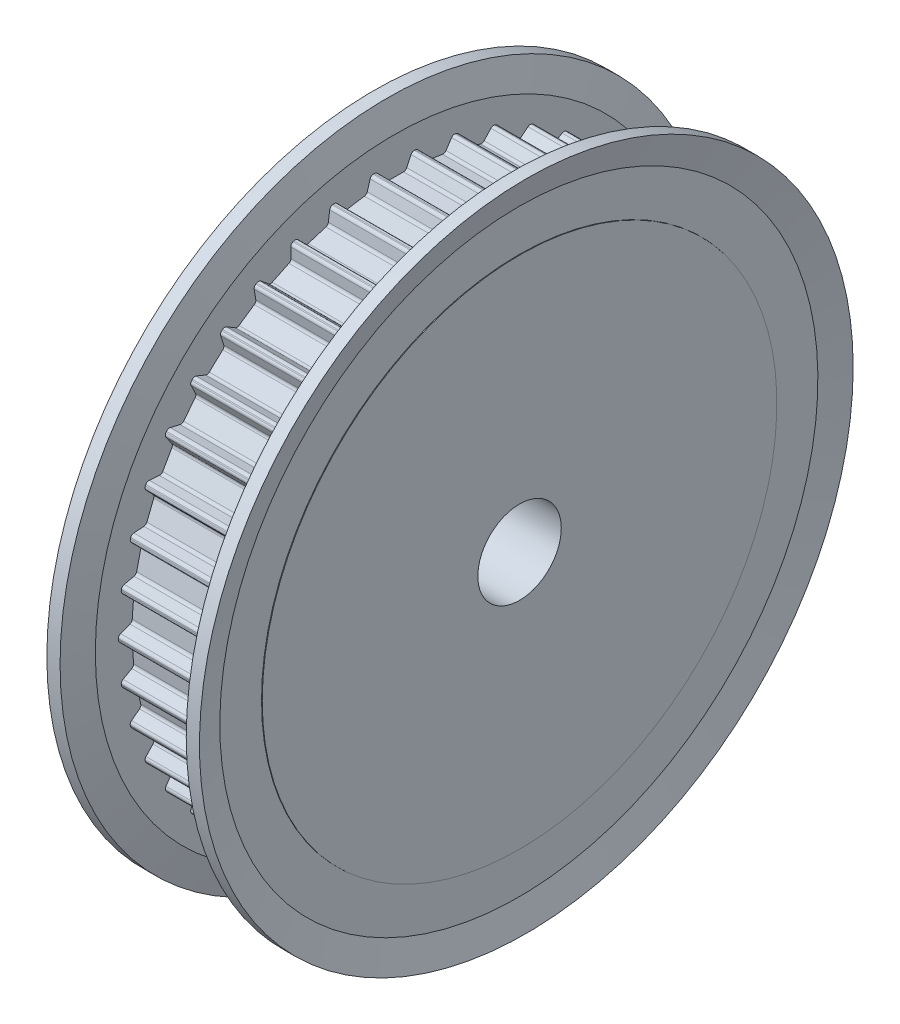
from build123d import *

# Parameters (mm, degrees)
REVOLVE1_START               = 0.05
REVOLVE1_DEPTH               = 9.9
REVOLVE1_START_2             = 9.535898285
REVOLVE1_2_OUTLINE_R         = 23.5
REVOLVE1_2_DEPTH             = 0.414101715
REVOLVE1_3_OUTLINE_R         = 23.5
REVOLVE1_3_DEPTH             = 0.414101515
REVOLVE1_4_OUTLINE_R         = 18.5
REVOLVE1_4_DEPTH             = 0.05
F_6_0_6_DIAMETER_HOLE1_D     = 6
F_6_0_6_DIAMETER_HOLE1_DEPTH = 16.485898385
FILLET1_R                    = 0.25
SKETCH6_R                    = 13
CUT_EXTRUDE2_DEPTH           = 6


with BuildPart() as part:
    # Revolve1: read off the stored shape, not the designer's step
    # Revolve1 outline → Revolve1 (new body)
    with BuildSketch(Plane.YZ.offset(REVOLVE1_START)):
        with BuildLine():
            ThreePointArc((-8.802769772, -17.791395233), (-8.612592221, -17.884232028), (-8.421435729, -17.975036029))
            Line((-8.421435729, -17.975036029), (-7.654649152, -17.245563817))
            Line((-7.654649152, -17.245563817), (-6.118707467, -17.848376507))
            Line((-6.118707467, -17.848376507), (-6.052780243, -18.904664803))
            ThreePointArc((-6.052780243, -18.904664803), (-5.850890212, -18.968120195), (-5.648335146, -19.029419594))
            Line((-5.648335146, -19.029419594), (-4.998835133, -18.193811374))
            Line((-4.998835133, -18.193811374), (-3.390204078, -18.560970915))
            Line((-3.390204078, -18.560970915), (-3.167581605, -19.595635401))
            ThreePointArc((-3.167581605, -19.595635401), (-2.958488984, -19.628291901), (-2.749060089, -19.65871737))
            Line((-2.749060089, -19.65871737), (-2.231355397, -18.73563925))
            Line((-2.231355397, -18.73563925), (-0.585969131, -18.858943904))
            Line((-0.585969131, -18.858943904), (-0.211624428, -19.848871885))
            ThreePointArc((-0.211624428, -19.848871885), (0, -19.85), (0.211624428, -19.848871885))
            Line((0.211624428, -19.848871885), (0.585969131, -18.858943904))
            Line((0.585969131, -18.858943904), (2.231355397, -18.73563925))
            Line((2.231355397, -18.73563925), (2.749060089, -19.65871737))
            ThreePointArc((2.749060089, -19.65871737), (2.958488984, -19.628291901), (3.167581605, -19.595635401))
            Line((3.167581605, -19.595635401), (3.390204078, -18.560970915))
            Line((3.390204078, -18.560970915), (4.998835133, -18.193811374))
            Line((4.998835133, -18.193811374), (5.648335146, -19.029419594))
            ThreePointArc((5.648335146, -19.029419594), (5.850890212, -18.968120195), (6.052780243, -18.904664803))
            Line((6.052780243, -18.904664803), (6.118707467, -17.848376507))
            Line((6.118707467, -17.848376507), (7.654649152, -17.245563817))
            Line((7.654649152, -17.245563817), (8.421435729, -17.975036029))
            ThreePointArc((8.421435729, -17.975036029), (8.612592221, -17.884232028), (8.802769772, -17.791395233))
            Line((8.802769772, -17.791395233), (8.710529042, -16.737078861))
            Line((8.710529042, -16.737078861), (10.139470958, -15.912078861))
            Line((10.139470958, -15.912078861), (11.006415354, -16.519119863))
            ThreePointArc((11.006415354, -16.519119863), (11.181903152, -16.40083967), (11.356119971, -16.280695293))
            Line((11.356119971, -16.280695293), (11.107771792, -15.251902531))
            Line((11.107771792, -15.251902531), (12.397793738, -14.223144358))
            Line((12.397793738, -14.223144358), (13.345529848, -14.694193856))
            ThreePointArc((13.345529848, -14.694193856), (13.501428845, -14.551079656), (13.655793215, -14.406311522))
            Line((13.655793215, -14.406311522), (13.256885275, -13.426023901))
            Line((13.256885275, -13.426023901), (14.379170293, -12.216488313))
            Line((14.379170293, -12.216488313), (15.386527258, -12.541023839))
            ThreePointArc((15.386527258, -12.541023839), (15.519354927, -12.376272567), (15.650418604, -12.210114558))
            Line((15.650418604, -12.210114558), (15.109861848, -11.300230083))
            Line((15.109861848, -11.300230083), (16.039339944, -9.936936106))
            Line((16.039339944, -9.936936106), (17.083815075, -10.107708073))
            ThreePointArc((17.083815075, -10.107708073), (17.190604265, -9.925), (17.295439503, -9.741163812))
            Line((17.295439503, -9.741163812), (16.625309075, -8.922007798))
            Line((16.625309075, -8.922007798), (17.341217245, -7.435409166))
            Line((17.341217245, -7.435409166), (18.399478692, -7.448602812))
            ThreePointArc((18.399478692, -7.448602812), (18.477843911, -7.252019334), (18.554108863, -7.054611562))
            Line((18.554108863, -7.054611562), (17.76937437, -6.344482602))
            Line((17.76937437, -6.344482602), (18.255720408, -4.767787473))
            Line((18.255720408, -4.767787473), (19.30412836, -4.623108072))
            ThreePointArc((19.30412836, -4.623108072), (19.352319057, -4.417040539), (19.398310091, -4.210470948))
            Line((19.398310091, -4.210470948), (18.516501205, -3.625232149))
            Line((18.516501205, -3.625232149), (18.762420944, -1.993661286))
            Line((18.762420944, -1.993661286), (19.7775557, -1.694340737))
            ThreePointArc((19.7775557, -1.694340737), (19.794495374, -1.483392358), (19.809185127, -1.27227537))
            Line((19.809185127, -1.27227537), (18.85, -0.825))
            Line((18.85, -0.825), (18.85, 0.825))
            Line((18.85, 0.825), (19.809185127, 1.27227537))
            ThreePointArc((19.809185127, 1.27227537), (19.794495374, 1.483392358), (19.7775557, 1.694340737))
            Line((19.7775557, 1.694340737), (18.762420944, 1.993661286))
            Line((18.762420944, 1.993661286), (18.516501205, 3.625232149))
            Line((18.516501205, 3.625232149), (19.398310091, 4.210470948))
            ThreePointArc((19.398310091, 4.210470948), (19.352319057, 4.417040539), (19.30412836, 4.623108072))
            Line((19.30412836, 4.623108072), (18.255720408, 4.767787473))
            Line((18.255720408, 4.767787473), (17.76937437, 6.344482602))
            Line((17.76937437, 6.344482602), (18.554108863, 7.054611562))
            ThreePointArc((18.554108863, 7.054611562), (18.477843911, 7.252019334), (18.399478692, 7.448602812))
            Line((18.399478692, 7.448602812), (17.341217245, 7.435409166))
            Line((17.341217245, 7.435409166), (16.625309075, 8.922007798))
            Line((16.625309075, 8.922007798), (17.295439503, 9.741163812))
            ThreePointArc((17.295439503, 9.741163812), (17.190604265, 9.925), (17.083815075, 10.107708073))
            Line((17.083815075, 10.107708073), (16.039339944, 9.936936106))
            Line((16.039339944, 9.936936106), (15.109861848, 11.300230083))
            Line((15.109861848, 11.300230083), (15.650418604, 12.210114558))
            ThreePointArc((15.650418604, 12.210114558), (15.519354927, 12.376272567), (15.386527258, 12.541023839))
            Line((15.386527258, 12.541023839), (14.379170293, 12.216488313))
            Line((14.379170293, 12.216488313), (13.256885275, 13.426023901))
            Line((13.256885275, 13.426023901), (13.655793215, 14.406311522))
            ThreePointArc((13.655793215, 14.406311522), (13.501428845, 14.551079656), (13.345529848, 14.694193856))
            Line((13.345529848, 14.694193856), (12.397793738, 14.223144358))
            Line((12.397793738, 14.223144358), (11.107771792, 15.251902531))
            Line((11.107771792, 15.251902531), (11.356119971, 16.280695293))
            ThreePointArc((11.356119971, 16.280695293), (11.181903152, 16.40083967), (11.006415354, 16.519119863))
            Line((11.006415354, 16.519119863), (10.139470958, 15.912078861))
            Line((10.139470958, 15.912078861), (8.710529042, 16.737078861))
            Line((8.710529042, 16.737078861), (8.802769772, 17.791395233))
            ThreePointArc((8.802769772, 17.791395233), (8.612592221, 17.884232028), (8.421435729, 17.975036029))
            Line((8.421435729, 17.975036029), (7.654649152, 17.245563817))
            Line((7.654649152, 17.245563817), (6.118707467, 17.848376507))
            Line((6.118707467, 17.848376507), (6.052780243, 18.904664803))
            ThreePointArc((6.052780243, 18.904664803), (5.850890212, 18.968120195), (5.648335146, 19.029419594))
            Line((5.648335146, 19.029419594), (4.998835133, 18.193811374))
            Line((4.998835133, 18.193811374), (3.390204078, 18.560970915))
            Line((3.390204078, 18.560970915), (3.167581605, 19.595635401))
            ThreePointArc((3.167581605, 19.595635401), (2.958488984, 19.628291901), (2.749060089, 19.65871737))
            Line((2.749060089, 19.65871737), (2.231355397, 18.73563925))
            Line((2.231355397, 18.73563925), (0.585969131, 18.858943904))
            Line((0.585969131, 18.858943904), (0.211624428, 19.848871885))
            ThreePointArc((0.211624428, 19.848871885), (0, 19.85), (-0.211624428, 19.848871885))
            Line((-0.211624428, 19.848871885), (-0.585969131, 18.858943904))
            Line((-0.585969131, 18.858943904), (-2.231355397, 18.73563925))
            Line((-2.231355397, 18.73563925), (-2.749060089, 19.65871737))
            ThreePointArc((-2.749060089, 19.65871737), (-2.958488984, 19.628291901), (-3.167581605, 19.595635401))
            Line((-3.167581605, 19.595635401), (-3.390204078, 18.560970915))
            Line((-3.390204078, 18.560970915), (-4.998835133, 18.193811374))
            Line((-4.998835133, 18.193811374), (-5.648335146, 19.029419594))
            ThreePointArc((-5.648335146, 19.029419594), (-5.850890212, 18.968120195), (-6.052780243, 18.904664803))
            Line((-6.052780243, 18.904664803), (-6.118707467, 17.848376507))
            Line((-6.118707467, 17.848376507), (-7.654649152, 17.245563817))
            Line((-7.654649152, 17.245563817), (-8.421435729, 17.975036029))
            ThreePointArc((-8.421435729, 17.975036029), (-8.612592221, 17.884232028), (-8.802769772, 17.791395233))
            Line((-8.802769772, 17.791395233), (-8.710529042, 16.737078861))
            Line((-8.710529042, 16.737078861), (-10.139470958, 15.912078861))
            Line((-10.139470958, 15.912078861), (-11.006415354, 16.519119863))
            ThreePointArc((-11.006415354, 16.519119863), (-11.181903152, 16.40083967), (-11.356119971, 16.280695293))
            Line((-11.356119971, 16.280695293), (-11.107771792, 15.251902531))
            Line((-11.107771792, 15.251902531), (-12.397793738, 14.223144358))
            Line((-12.397793738, 14.223144358), (-13.345529848, 14.694193856))
            ThreePointArc((-13.345529848, 14.694193856), (-13.501428845, 14.551079656), (-13.655793215, 14.406311522))
            Line((-13.655793215, 14.406311522), (-13.256885275, 13.426023901))
            Line((-13.256885275, 13.426023901), (-14.379170293, 12.216488313))
            Line((-14.379170293, 12.216488313), (-15.386527258, 12.541023839))
            ThreePointArc((-15.386527258, 12.541023839), (-15.519354927, 12.376272567), (-15.650418604, 12.210114558))
            Line((-15.650418604, 12.210114558), (-15.109861848, 11.300230083))
            Line((-15.109861848, 11.300230083), (-16.039339944, 9.936936106))
            Line((-16.039339944, 9.936936106), (-17.083815075, 10.107708073))
            ThreePointArc((-17.083815075, 10.107708073), (-17.190604265, 9.925), (-17.295439503, 9.741163812))
            Line((-17.295439503, 9.741163812), (-16.625309075, 8.922007798))
            Line((-16.625309075, 8.922007798), (-17.341217245, 7.435409166))
            Line((-17.341217245, 7.435409166), (-18.399478692, 7.448602812))
            ThreePointArc((-18.399478692, 7.448602812), (-18.477843911, 7.252019334), (-18.554108863, 7.054611562))
            Line((-18.554108863, 7.054611562), (-17.76937437, 6.344482602))
            Line((-17.76937437, 6.344482602), (-18.255720408, 4.767787473))
            Line((-18.255720408, 4.767787473), (-19.30412836, 4.623108072))
            ThreePointArc((-19.30412836, 4.623108072), (-19.352319057, 4.417040539), (-19.398310091, 4.210470948))
            Line((-19.398310091, 4.210470948), (-18.516501205, 3.625232149))
            Line((-18.516501205, 3.625232149), (-18.762420944, 1.993661286))
            Line((-18.762420944, 1.993661286), (-19.7775557, 1.694340737))
            ThreePointArc((-19.7775557, 1.694340737), (-19.794495374, 1.483392358), (-19.809185127, 1.27227537))
            Line((-19.809185127, 1.27227537), (-18.85, 0.825))
            Line((-18.85, 0.825), (-18.85, -0.825))
            Line((-18.85, -0.825), (-19.809185127, -1.27227537))
            ThreePointArc((-19.809185127, -1.27227537), (-19.794495374, -1.483392358), (-19.7775557, -1.694340737))
            Line((-19.7775557, -1.694340737), (-18.762420944, -1.993661286))
            Line((-18.762420944, -1.993661286), (-18.516501205, -3.625232149))
            Line((-18.516501205, -3.625232149), (-19.398310091, -4.210470948))
            ThreePointArc((-19.398310091, -4.210470948), (-19.352319057, -4.417040539), (-19.30412836, -4.623108072))
            Line((-19.30412836, -4.623108072), (-18.255720408, -4.767787473))
            Line((-18.255720408, -4.767787473), (-17.76937437, -6.344482602))
            Line((-17.76937437, -6.344482602), (-18.554108863, -7.054611562))
            ThreePointArc((-18.554108863, -7.054611562), (-18.477843911, -7.252019334), (-18.399478692, -7.448602812))
            Line((-18.399478692, -7.448602812), (-17.341217245, -7.435409166))
            Line((-17.341217245, -7.435409166), (-16.625309075, -8.922007798))
            Line((-16.625309075, -8.922007798), (-17.295439503, -9.741163812))
            ThreePointArc((-17.295439503, -9.741163812), (-17.190604265, -9.925), (-17.083815075, -10.107708073))
            Line((-17.083815075, -10.107708073), (-16.039339944, -9.936936106))
            Line((-16.039339944, -9.936936106), (-15.109861848, -11.300230083))
            Line((-15.109861848, -11.300230083), (-15.650418604, -12.210114558))
            ThreePointArc((-15.650418604, -12.210114558), (-15.519354927, -12.376272567), (-15.386527258, -12.541023839))
            Line((-15.386527258, -12.541023839), (-14.379170293, -12.216488313))
            Line((-14.379170293, -12.216488313), (-13.256885275, -13.426023901))
            Line((-13.256885275, -13.426023901), (-13.655793215, -14.406311522))
            ThreePointArc((-13.655793215, -14.406311522), (-13.501428845, -14.551079656), (-13.345529848, -14.694193856))
            Line((-13.345529848, -14.694193856), (-12.397793738, -14.223144358))
            Line((-12.397793738, -14.223144358), (-11.107771792, -15.251902531))
            Line((-11.107771792, -15.251902531), (-11.356119971, -16.280695293))
            ThreePointArc((-11.356119971, -16.280695293), (-11.181903152, -16.40083967), (-11.006415354, -16.519119863))
            Line((-11.006415354, -16.519119863), (-10.139470958, -15.912078861))
            Line((-10.139470958, -15.912078861), (-8.710529042, -16.737078861))
            Line((-8.710529042, -16.737078861), (-8.802769772, -17.791395233))
        make_face()
    extrude(amount=REVOLVE1_DEPTH)

    # Revolve1 2 outline → Revolve1 2 (add)
    with BuildSketch(Plane.YZ.offset(REVOLVE1_START_2)):
        Circle(REVOLVE1_2_OUTLINE_R)
        with BuildLine():
            Line((-7.654649152, -17.245563817), (-8.421435729, -17.975036029))
            ThreePointArc((-8.421435729, -17.975036029), (-8.612592221, -17.884232028), (-8.802769772, -17.791395233))
            Line((-8.802769772, -17.791395233), (-8.710529042, -16.737078861))
            Line((-8.710529042, -16.737078861), (-10.139470958, -15.912078861))
            Line((-10.139470958, -15.912078861), (-11.006415354, -16.519119863))
            ThreePointArc((-11.006415354, -16.519119863), (-11.181903152, -16.40083967), (-11.356119971, -16.280695293))
            Line((-11.356119971, -16.280695293), (-11.107771792, -15.251902531))
            Line((-11.107771792, -15.251902531), (-12.397793738, -14.223144358))
            Line((-12.397793738, -14.223144358), (-13.345529848, -14.694193856))
            ThreePointArc((-13.345529848, -14.694193856), (-13.501428845, -14.551079656), (-13.655793215, -14.406311522))
            Line((-13.655793215, -14.406311522), (-13.256885275, -13.426023901))
            Line((-13.256885275, -13.426023901), (-14.379170293, -12.216488313))
            Line((-14.379170293, -12.216488313), (-15.386527258, -12.541023839))
            ThreePointArc((-15.386527258, -12.541023839), (-15.519354927, -12.376272567), (-15.650418604, -12.210114558))
            Line((-15.650418604, -12.210114558), (-15.109861848, -11.300230083))
            Line((-15.109861848, -11.300230083), (-16.039339944, -9.936936106))
            Line((-16.039339944, -9.936936106), (-17.083815075, -10.107708073))
            ThreePointArc((-17.083815075, -10.107708073), (-17.190604265, -9.925), (-17.295439503, -9.741163812))
            Line((-17.295439503, -9.741163812), (-16.625309075, -8.922007798))
            Line((-16.625309075, -8.922007798), (-17.341217245, -7.435409166))
            Line((-17.341217245, -7.435409166), (-18.399478692, -7.448602812))
            ThreePointArc((-18.399478692, -7.448602812), (-18.477843911, -7.252019334), (-18.554108863, -7.054611562))
            Line((-18.554108863, -7.054611562), (-17.76937437, -6.344482602))
            Line((-17.76937437, -6.344482602), (-18.255720408, -4.767787473))
            Line((-18.255720408, -4.767787473), (-19.30412836, -4.623108072))
            ThreePointArc((-19.30412836, -4.623108072), (-19.352319057, -4.417040539), (-19.398310091, -4.210470948))
            Line((-19.398310091, -4.210470948), (-18.516501205, -3.625232149))
            Line((-18.516501205, -3.625232149), (-18.762420944, -1.993661286))
            Line((-18.762420944, -1.993661286), (-19.7775557, -1.694340737))
            ThreePointArc((-19.7775557, -1.694340737), (-19.794495374, -1.483392358), (-19.809185127, -1.27227537))
            Line((-19.809185127, -1.27227537), (-18.85, -0.825))
            Line((-18.85, -0.825), (-18.85, 0.825))
            Line((-18.85, 0.825), (-19.809185127, 1.27227537))
            ThreePointArc((-19.809185127, 1.27227537), (-19.794495374, 1.483392358), (-19.7775557, 1.694340737))
            Line((-19.7775557, 1.694340737), (-18.762420944, 1.993661286))
            Line((-18.762420944, 1.993661286), (-18.516501205, 3.625232149))
            Line((-18.516501205, 3.625232149), (-19.398310091, 4.210470948))
            ThreePointArc((-19.398310091, 4.210470948), (-19.352319057, 4.417040539), (-19.30412836, 4.623108072))
            Line((-19.30412836, 4.623108072), (-18.255720408, 4.767787473))
            Line((-18.255720408, 4.767787473), (-17.76937437, 6.344482602))
            Line((-17.76937437, 6.344482602), (-18.554108863, 7.054611562))
            ThreePointArc((-18.554108863, 7.054611562), (-18.477843911, 7.252019334), (-18.399478692, 7.448602812))
            Line((-18.399478692, 7.448602812), (-17.341217245, 7.435409166))
            Line((-17.341217245, 7.435409166), (-16.625309075, 8.922007798))
            Line((-16.625309075, 8.922007798), (-17.295439503, 9.741163812))
            ThreePointArc((-17.295439503, 9.741163812), (-17.190604265, 9.925), (-17.083815075, 10.107708073))
            Line((-17.083815075, 10.107708073), (-16.039339944, 9.936936106))
            Line((-16.039339944, 9.936936106), (-15.109861848, 11.300230083))
            Line((-15.109861848, 11.300230083), (-15.650418604, 12.210114558))
            ThreePointArc((-15.650418604, 12.210114558), (-15.519354927, 12.376272567), (-15.386527258, 12.541023839))
            Line((-15.386527258, 12.541023839), (-14.379170293, 12.216488313))
            Line((-14.379170293, 12.216488313), (-13.256885275, 13.426023901))
            Line((-13.256885275, 13.426023901), (-13.655793215, 14.406311522))
            ThreePointArc((-13.655793215, 14.406311522), (-13.501428845, 14.551079656), (-13.345529848, 14.694193856))
            Line((-13.345529848, 14.694193856), (-12.397793738, 14.223144358))
            Line((-12.397793738, 14.223144358), (-11.107771792, 15.251902531))
            Line((-11.107771792, 15.251902531), (-11.356119971, 16.280695293))
            ThreePointArc((-11.356119971, 16.280695293), (-11.181903152, 16.40083967), (-11.006415354, 16.519119863))
            Line((-11.006415354, 16.519119863), (-10.139470958, 15.912078861))
            Line((-10.139470958, 15.912078861), (-8.710529042, 16.737078861))
            Line((-8.710529042, 16.737078861), (-8.802769772, 17.791395233))
            ThreePointArc((-8.802769772, 17.791395233), (-8.612592221, 17.884232028), (-8.421435729, 17.975036029))
            Line((-8.421435729, 17.975036029), (-7.654649152, 17.245563817))
            Line((-7.654649152, 17.245563817), (-6.118707467, 17.848376507))
            Line((-6.118707467, 17.848376507), (-6.052780243, 18.904664803))
            ThreePointArc((-6.052780243, 18.904664803), (-5.850890212, 18.968120195), (-5.648335146, 19.029419594))
            Line((-5.648335146, 19.029419594), (-4.998835133, 18.193811374))
            Line((-4.998835133, 18.193811374), (-3.390204078, 18.560970915))
            Line((-3.390204078, 18.560970915), (-3.167581605, 19.595635401))
            ThreePointArc((-3.167581605, 19.595635401), (-2.958488984, 19.628291901), (-2.749060089, 19.65871737))
            Line((-2.749060089, 19.65871737), (-2.231355397, 18.73563925))
            Line((-2.231355397, 18.73563925), (-0.585969131, 18.858943904))
            Line((-0.585969131, 18.858943904), (-0.211624428, 19.848871885))
            ThreePointArc((-0.211624428, 19.848871885), (0, 19.85), (0.211624428, 19.848871885))
            Line((0.211624428, 19.848871885), (0.585969131, 18.858943904))
            Line((0.585969131, 18.858943904), (2.231355397, 18.73563925))
            Line((2.231355397, 18.73563925), (2.749060089, 19.65871737))
            ThreePointArc((2.749060089, 19.65871737), (2.958488984, 19.628291901), (3.167581605, 19.595635401))
            Line((3.167581605, 19.595635401), (3.390204078, 18.560970915))
            Line((3.390204078, 18.560970915), (4.998835133, 18.193811374))
            Line((4.998835133, 18.193811374), (5.648335146, 19.029419594))
            ThreePointArc((5.648335146, 19.029419594), (5.850890212, 18.968120195), (6.052780243, 18.904664803))
            Line((6.052780243, 18.904664803), (6.118707467, 17.848376507))
            Line((6.118707467, 17.848376507), (7.654649152, 17.245563817))
            Line((7.654649152, 17.245563817), (8.421435729, 17.975036029))
            ThreePointArc((8.421435729, 17.975036029), (8.612592221, 17.884232028), (8.802769772, 17.791395233))
            Line((8.802769772, 17.791395233), (8.710529042, 16.737078861))
            Line((8.710529042, 16.737078861), (10.139470958, 15.912078861))
            Line((10.139470958, 15.912078861), (11.006415354, 16.519119863))
            ThreePointArc((11.006415354, 16.519119863), (11.181903152, 16.40083967), (11.356119971, 16.280695293))
            Line((11.356119971, 16.280695293), (11.107771792, 15.251902531))
            Line((11.107771792, 15.251902531), (12.397793738, 14.223144358))
            Line((12.397793738, 14.223144358), (13.345529848, 14.694193856))
            ThreePointArc((13.345529848, 14.694193856), (13.501428845, 14.551079656), (13.655793215, 14.406311522))
            Line((13.655793215, 14.406311522), (13.256885275, 13.426023901))
            Line((13.256885275, 13.426023901), (14.379170293, 12.216488313))
            Line((14.379170293, 12.216488313), (15.386527258, 12.541023839))
            ThreePointArc((15.386527258, 12.541023839), (15.519354927, 12.376272567), (15.650418604, 12.210114558))
            Line((15.650418604, 12.210114558), (15.109861848, 11.300230083))
            Line((15.109861848, 11.300230083), (16.039339944, 9.936936106))
            Line((16.039339944, 9.936936106), (17.083815075, 10.107708073))
            ThreePointArc((17.083815075, 10.107708073), (17.190604265, 9.925), (17.295439503, 9.741163812))
            Line((17.295439503, 9.741163812), (16.625309075, 8.922007798))
            Line((16.625309075, 8.922007798), (17.341217245, 7.435409166))
            Line((17.341217245, 7.435409166), (18.399478692, 7.448602812))
            ThreePointArc((18.399478692, 7.448602812), (18.477843911, 7.252019334), (18.554108863, 7.054611562))
            Line((18.554108863, 7.054611562), (17.76937437, 6.344482602))
            Line((17.76937437, 6.344482602), (18.255720408, 4.767787473))
            Line((18.255720408, 4.767787473), (19.30412836, 4.623108072))
            ThreePointArc((19.30412836, 4.623108072), (19.352319057, 4.417040539), (19.398310091, 4.210470948))
            Line((19.398310091, 4.210470948), (18.516501205, 3.625232149))
            Line((18.516501205, 3.625232149), (18.762420944, 1.993661286))
            Line((18.762420944, 1.993661286), (19.7775557, 1.694340737))
            ThreePointArc((19.7775557, 1.694340737), (19.794495374, 1.483392358), (19.809185127, 1.27227537))
            Line((19.809185127, 1.27227537), (18.85, 0.825))
            Line((18.85, 0.825), (18.85, -0.825))
            Line((18.85, -0.825), (19.809185127, -1.27227537))
            ThreePointArc((19.809185127, -1.27227537), (19.794495374, -1.483392358), (19.7775557, -1.694340737))
            Line((19.7775557, -1.694340737), (18.762420944, -1.993661286))
            Line((18.762420944, -1.993661286), (18.516501205, -3.625232149))
            Line((18.516501205, -3.625232149), (19.398310091, -4.210470948))
            ThreePointArc((19.398310091, -4.210470948), (19.352319057, -4.417040539), (19.30412836, -4.623108072))
            Line((19.30412836, -4.623108072), (18.255720408, -4.767787473))
            Line((18.255720408, -4.767787473), (17.76937437, -6.344482602))
            Line((17.76937437, -6.344482602), (18.554108863, -7.054611562))
            ThreePointArc((18.554108863, -7.054611562), (18.477843911, -7.252019334), (18.399478692, -7.448602812))
            Line((18.399478692, -7.448602812), (17.341217245, -7.435409166))
            Line((17.341217245, -7.435409166), (16.625309075, -8.922007798))
            Line((16.625309075, -8.922007798), (17.295439503, -9.741163812))
            ThreePointArc((17.295439503, -9.741163812), (17.190604265, -9.925), (17.083815075, -10.107708073))
            Line((17.083815075, -10.107708073), (16.039339944, -9.936936106))
            Line((16.039339944, -9.936936106), (15.109861848, -11.300230083))
            Line((15.109861848, -11.300230083), (15.650418604, -12.210114558))
            ThreePointArc((15.650418604, -12.210114558), (15.519354927, -12.376272567), (15.386527258, -12.541023839))
            Line((15.386527258, -12.541023839), (14.379170293, -12.216488313))
            Line((14.379170293, -12.216488313), (13.256885275, -13.426023901))
            Line((13.256885275, -13.426023901), (13.655793215, -14.406311522))
            ThreePointArc((13.655793215, -14.406311522), (13.501428845, -14.551079656), (13.345529848, -14.694193856))
            Line((13.345529848, -14.694193856), (12.397793738, -14.223144358))
            Line((12.397793738, -14.223144358), (11.107771792, -15.251902531))
            Line((11.107771792, -15.251902531), (11.356119971, -16.280695293))
            ThreePointArc((11.356119971, -16.280695293), (11.181903152, -16.40083967), (11.006415354, -16.519119863))
            Line((11.006415354, -16.519119863), (10.139470958, -15.912078861))
            Line((10.139470958, -15.912078861), (8.710529042, -16.737078861))
            Line((8.710529042, -16.737078861), (8.802769772, -17.791395233))
            ThreePointArc((8.802769772, -17.791395233), (8.612592221, -17.884232028), (8.421435729, -17.975036029))
            Line((8.421435729, -17.975036029), (7.654649152, -17.245563817))
            Line((7.654649152, -17.245563817), (6.118707467, -17.848376507))
            Line((6.118707467, -17.848376507), (6.052780243, -18.904664803))
            ThreePointArc((6.052780243, -18.904664803), (5.850890212, -18.968120195), (5.648335146, -19.029419594))
            Line((5.648335146, -19.029419594), (4.998835133, -18.193811374))
            Line((4.998835133, -18.193811374), (3.390204078, -18.560970915))
            Line((3.390204078, -18.560970915), (3.167581605, -19.595635401))
            ThreePointArc((3.167581605, -19.595635401), (2.958488984, -19.628291901), (2.749060089, -19.65871737))
            Line((2.749060089, -19.65871737), (2.231355397, -18.73563925))
            Line((2.231355397, -18.73563925), (0.585969131, -18.858943904))
            Line((0.585969131, -18.858943904), (0.211624428, -19.848871885))
            ThreePointArc((0.211624428, -19.848871885), (0, -19.85), (-0.211624428, -19.848871885))
            Line((-0.211624428, -19.848871885), (-0.585969131, -18.858943904))
            Line((-0.585969131, -18.858943904), (-2.231355397, -18.73563925))
            Line((-2.231355397, -18.73563925), (-2.749060089, -19.65871737))
            ThreePointArc((-2.749060089, -19.65871737), (-2.958488984, -19.628291901), (-3.167581605, -19.595635401))
            Line((-3.167581605, -19.595635401), (-3.390204078, -18.560970915))
            Line((-3.390204078, -18.560970915), (-4.998835133, -18.193811374))
            Line((-4.998835133, -18.193811374), (-5.648335146, -19.029419594))
            ThreePointArc((-5.648335146, -19.029419594), (-5.850890212, -18.968120195), (-6.052780243, -18.904664803))
            Line((-6.052780243, -18.904664803), (-6.118707467, -17.848376507))
            Line((-6.118707467, -17.848376507), (-7.654649152, -17.245563817))
        make_face(mode=Mode.SUBTRACT)
    extrude(amount=REVOLVE1_2_DEPTH)

    # Revolve1 3 outline → Revolve1 3 (add)
    with BuildSketch(Plane.YZ.offset(REVOLVE1_START)):
        Circle(REVOLVE1_3_OUTLINE_R)
        with BuildLine():
            Line((-7.654649152, -17.245563817), (-8.421435729, -17.975036029))
            ThreePointArc((-8.421435729, -17.975036029), (-8.612592221, -17.884232028), (-8.802769772, -17.791395233))
            Line((-8.802769772, -17.791395233), (-8.710529042, -16.737078861))
            Line((-8.710529042, -16.737078861), (-10.139470958, -15.912078861))
            Line((-10.139470958, -15.912078861), (-11.006415354, -16.519119863))
            ThreePointArc((-11.006415354, -16.519119863), (-11.181903152, -16.40083967), (-11.356119971, -16.280695293))
            Line((-11.356119971, -16.280695293), (-11.107771792, -15.251902531))
            Line((-11.107771792, -15.251902531), (-12.397793738, -14.223144358))
            Line((-12.397793738, -14.223144358), (-13.345529848, -14.694193856))
            ThreePointArc((-13.345529848, -14.694193856), (-13.501428845, -14.551079656), (-13.655793215, -14.406311522))
            Line((-13.655793215, -14.406311522), (-13.256885275, -13.426023901))
            Line((-13.256885275, -13.426023901), (-14.379170293, -12.216488313))
            Line((-14.379170293, -12.216488313), (-15.386527258, -12.541023839))
            ThreePointArc((-15.386527258, -12.541023839), (-15.519354927, -12.376272567), (-15.650418604, -12.210114558))
            Line((-15.650418604, -12.210114558), (-15.109861848, -11.300230083))
            Line((-15.109861848, -11.300230083), (-16.039339944, -9.936936106))
            Line((-16.039339944, -9.936936106), (-17.083815075, -10.107708073))
            ThreePointArc((-17.083815075, -10.107708073), (-17.190604265, -9.925), (-17.295439503, -9.741163812))
            Line((-17.295439503, -9.741163812), (-16.625309075, -8.922007798))
            Line((-16.625309075, -8.922007798), (-17.341217245, -7.435409166))
            Line((-17.341217245, -7.435409166), (-18.399478692, -7.448602812))
            ThreePointArc((-18.399478692, -7.448602812), (-18.477843911, -7.252019334), (-18.554108863, -7.054611562))
            Line((-18.554108863, -7.054611562), (-17.76937437, -6.344482602))
            Line((-17.76937437, -6.344482602), (-18.255720408, -4.767787473))
            Line((-18.255720408, -4.767787473), (-19.30412836, -4.623108072))
            ThreePointArc((-19.30412836, -4.623108072), (-19.352319057, -4.417040539), (-19.398310091, -4.210470948))
            Line((-19.398310091, -4.210470948), (-18.516501205, -3.625232149))
            Line((-18.516501205, -3.625232149), (-18.762420944, -1.993661286))
            Line((-18.762420944, -1.993661286), (-19.7775557, -1.694340737))
            ThreePointArc((-19.7775557, -1.694340737), (-19.794495374, -1.483392358), (-19.809185127, -1.27227537))
            Line((-19.809185127, -1.27227537), (-18.85, -0.825))
            Line((-18.85, -0.825), (-18.85, 0.825))
            Line((-18.85, 0.825), (-19.809185127, 1.27227537))
            ThreePointArc((-19.809185127, 1.27227537), (-19.794495374, 1.483392358), (-19.7775557, 1.694340737))
            Line((-19.7775557, 1.694340737), (-18.762420944, 1.993661286))
            Line((-18.762420944, 1.993661286), (-18.516501205, 3.625232149))
            Line((-18.516501205, 3.625232149), (-19.398310091, 4.210470948))
            ThreePointArc((-19.398310091, 4.210470948), (-19.352319057, 4.417040539), (-19.30412836, 4.623108072))
            Line((-19.30412836, 4.623108072), (-18.255720408, 4.767787473))
            Line((-18.255720408, 4.767787473), (-17.76937437, 6.344482602))
            Line((-17.76937437, 6.344482602), (-18.554108863, 7.054611562))
            ThreePointArc((-18.554108863, 7.054611562), (-18.477843911, 7.252019334), (-18.399478692, 7.448602812))
            Line((-18.399478692, 7.448602812), (-17.341217245, 7.435409166))
            Line((-17.341217245, 7.435409166), (-16.625309075, 8.922007798))
            Line((-16.625309075, 8.922007798), (-17.295439503, 9.741163812))
            ThreePointArc((-17.295439503, 9.741163812), (-17.190604265, 9.925), (-17.083815075, 10.107708073))
            Line((-17.083815075, 10.107708073), (-16.039339944, 9.936936106))
            Line((-16.039339944, 9.936936106), (-15.109861848, 11.300230083))
            Line((-15.109861848, 11.300230083), (-15.650418604, 12.210114558))
            ThreePointArc((-15.650418604, 12.210114558), (-15.519354927, 12.376272567), (-15.386527258, 12.541023839))
            Line((-15.386527258, 12.541023839), (-14.379170293, 12.216488313))
            Line((-14.379170293, 12.216488313), (-13.256885275, 13.426023901))
            Line((-13.256885275, 13.426023901), (-13.655793215, 14.406311522))
            ThreePointArc((-13.655793215, 14.406311522), (-13.501428845, 14.551079656), (-13.345529848, 14.694193856))
            Line((-13.345529848, 14.694193856), (-12.397793738, 14.223144358))
            Line((-12.397793738, 14.223144358), (-11.107771792, 15.251902531))
            Line((-11.107771792, 15.251902531), (-11.356119971, 16.280695293))
            ThreePointArc((-11.356119971, 16.280695293), (-11.181903152, 16.40083967), (-11.006415354, 16.519119863))
            Line((-11.006415354, 16.519119863), (-10.139470958, 15.912078861))
            Line((-10.139470958, 15.912078861), (-8.710529042, 16.737078861))
            Line((-8.710529042, 16.737078861), (-8.802769772, 17.791395233))
            ThreePointArc((-8.802769772, 17.791395233), (-8.612592221, 17.884232028), (-8.421435729, 17.975036029))
            Line((-8.421435729, 17.975036029), (-7.654649152, 17.245563817))
            Line((-7.654649152, 17.245563817), (-6.118707467, 17.848376507))
            Line((-6.118707467, 17.848376507), (-6.052780243, 18.904664803))
            ThreePointArc((-6.052780243, 18.904664803), (-5.850890212, 18.968120195), (-5.648335146, 19.029419594))
            Line((-5.648335146, 19.029419594), (-4.998835133, 18.193811374))
            Line((-4.998835133, 18.193811374), (-3.390204078, 18.560970915))
            Line((-3.390204078, 18.560970915), (-3.167581605, 19.595635401))
            ThreePointArc((-3.167581605, 19.595635401), (-2.958488984, 19.628291901), (-2.749060089, 19.65871737))
            Line((-2.749060089, 19.65871737), (-2.231355397, 18.73563925))
            Line((-2.231355397, 18.73563925), (-0.585969131, 18.858943904))
            Line((-0.585969131, 18.858943904), (-0.211624428, 19.848871885))
            ThreePointArc((-0.211624428, 19.848871885), (0, 19.85), (0.211624428, 19.848871885))
            Line((0.211624428, 19.848871885), (0.585969131, 18.858943904))
            Line((0.585969131, 18.858943904), (2.231355397, 18.73563925))
            Line((2.231355397, 18.73563925), (2.749060089, 19.65871737))
            ThreePointArc((2.749060089, 19.65871737), (2.958488984, 19.628291901), (3.167581605, 19.595635401))
            Line((3.167581605, 19.595635401), (3.390204078, 18.560970915))
            Line((3.390204078, 18.560970915), (4.998835133, 18.193811374))
            Line((4.998835133, 18.193811374), (5.648335146, 19.029419594))
            ThreePointArc((5.648335146, 19.029419594), (5.850890212, 18.968120195), (6.052780243, 18.904664803))
            Line((6.052780243, 18.904664803), (6.118707467, 17.848376507))
            Line((6.118707467, 17.848376507), (7.654649152, 17.245563817))
            Line((7.654649152, 17.245563817), (8.421435729, 17.975036029))
            ThreePointArc((8.421435729, 17.975036029), (8.612592221, 17.884232028), (8.802769772, 17.791395233))
            Line((8.802769772, 17.791395233), (8.710529042, 16.737078861))
            Line((8.710529042, 16.737078861), (10.139470958, 15.912078861))
            Line((10.139470958, 15.912078861), (11.006415354, 16.519119863))
            ThreePointArc((11.006415354, 16.519119863), (11.181903152, 16.40083967), (11.356119971, 16.280695293))
            Line((11.356119971, 16.280695293), (11.107771792, 15.251902531))
            Line((11.107771792, 15.251902531), (12.397793738, 14.223144358))
            Line((12.397793738, 14.223144358), (13.345529848, 14.694193856))
            ThreePointArc((13.345529848, 14.694193856), (13.501428845, 14.551079656), (13.655793215, 14.406311522))
            Line((13.655793215, 14.406311522), (13.256885275, 13.426023901))
            Line((13.256885275, 13.426023901), (14.379170293, 12.216488313))
            Line((14.379170293, 12.216488313), (15.386527258, 12.541023839))
            ThreePointArc((15.386527258, 12.541023839), (15.519354927, 12.376272567), (15.650418604, 12.210114558))
            Line((15.650418604, 12.210114558), (15.109861848, 11.300230083))
            Line((15.109861848, 11.300230083), (16.039339944, 9.936936106))
            Line((16.039339944, 9.936936106), (17.083815075, 10.107708073))
            ThreePointArc((17.083815075, 10.107708073), (17.190604265, 9.925), (17.295439503, 9.741163812))
            Line((17.295439503, 9.741163812), (16.625309075, 8.922007798))
            Line((16.625309075, 8.922007798), (17.341217245, 7.435409166))
            Line((17.341217245, 7.435409166), (18.399478692, 7.448602812))
            ThreePointArc((18.399478692, 7.448602812), (18.477843911, 7.252019334), (18.554108863, 7.054611562))
            Line((18.554108863, 7.054611562), (17.76937437, 6.344482602))
            Line((17.76937437, 6.344482602), (18.255720408, 4.767787473))
            Line((18.255720408, 4.767787473), (19.30412836, 4.623108072))
            ThreePointArc((19.30412836, 4.623108072), (19.352319057, 4.417040539), (19.398310091, 4.210470948))
            Line((19.398310091, 4.210470948), (18.516501205, 3.625232149))
            Line((18.516501205, 3.625232149), (18.762420944, 1.993661286))
            Line((18.762420944, 1.993661286), (19.7775557, 1.694340737))
            ThreePointArc((19.7775557, 1.694340737), (19.794495374, 1.483392358), (19.809185127, 1.27227537))
            Line((19.809185127, 1.27227537), (18.85, 0.825))
            Line((18.85, 0.825), (18.85, -0.825))
            Line((18.85, -0.825), (19.809185127, -1.27227537))
            ThreePointArc((19.809185127, -1.27227537), (19.794495374, -1.483392358), (19.7775557, -1.694340737))
            Line((19.7775557, -1.694340737), (18.762420944, -1.993661286))
            Line((18.762420944, -1.993661286), (18.516501205, -3.625232149))
            Line((18.516501205, -3.625232149), (19.398310091, -4.210470948))
            ThreePointArc((19.398310091, -4.210470948), (19.352319057, -4.417040539), (19.30412836, -4.623108072))
            Line((19.30412836, -4.623108072), (18.255720408, -4.767787473))
            Line((18.255720408, -4.767787473), (17.76937437, -6.344482602))
            Line((17.76937437, -6.344482602), (18.554108863, -7.054611562))
            ThreePointArc((18.554108863, -7.054611562), (18.477843911, -7.252019334), (18.399478692, -7.448602812))
            Line((18.399478692, -7.448602812), (17.341217245, -7.435409166))
            Line((17.341217245, -7.435409166), (16.625309075, -8.922007798))
            Line((16.625309075, -8.922007798), (17.295439503, -9.741163812))
            ThreePointArc((17.295439503, -9.741163812), (17.190604265, -9.925), (17.083815075, -10.107708073))
            Line((17.083815075, -10.107708073), (16.039339944, -9.936936106))
            Line((16.039339944, -9.936936106), (15.109861848, -11.300230083))
            Line((15.109861848, -11.300230083), (15.650418604, -12.210114558))
            ThreePointArc((15.650418604, -12.210114558), (15.519354927, -12.376272567), (15.386527258, -12.541023839))
            Line((15.386527258, -12.541023839), (14.379170293, -12.216488313))
            Line((14.379170293, -12.216488313), (13.256885275, -13.426023901))
            Line((13.256885275, -13.426023901), (13.655793215, -14.406311522))
            ThreePointArc((13.655793215, -14.406311522), (13.501428845, -14.551079656), (13.345529848, -14.694193856))
            Line((13.345529848, -14.694193856), (12.397793738, -14.223144358))
            Line((12.397793738, -14.223144358), (11.107771792, -15.251902531))
            Line((11.107771792, -15.251902531), (11.356119971, -16.280695293))
            ThreePointArc((11.356119971, -16.280695293), (11.181903152, -16.40083967), (11.006415354, -16.519119863))
            Line((11.006415354, -16.519119863), (10.139470958, -15.912078861))
            Line((10.139470958, -15.912078861), (8.710529042, -16.737078861))
            Line((8.710529042, -16.737078861), (8.802769772, -17.791395233))
            ThreePointArc((8.802769772, -17.791395233), (8.612592221, -17.884232028), (8.421435729, -17.975036029))
            Line((8.421435729, -17.975036029), (7.654649152, -17.245563817))
            Line((7.654649152, -17.245563817), (6.118707467, -17.848376507))
            Line((6.118707467, -17.848376507), (6.052780243, -18.904664803))
            ThreePointArc((6.052780243, -18.904664803), (5.850890212, -18.968120195), (5.648335146, -19.029419594))
            Line((5.648335146, -19.029419594), (4.998835133, -18.193811374))
            Line((4.998835133, -18.193811374), (3.390204078, -18.560970915))
            Line((3.390204078, -18.560970915), (3.167581605, -19.595635401))
            ThreePointArc((3.167581605, -19.595635401), (2.958488984, -19.628291901), (2.749060089, -19.65871737))
            Line((2.749060089, -19.65871737), (2.231355397, -18.73563925))
            Line((2.231355397, -18.73563925), (0.585969131, -18.858943904))
            Line((0.585969131, -18.858943904), (0.211624428, -19.848871885))
            ThreePointArc((0.211624428, -19.848871885), (0, -19.85), (-0.211624428, -19.848871885))
            Line((-0.211624428, -19.848871885), (-0.585969131, -18.858943904))
            Line((-0.585969131, -18.858943904), (-2.231355397, -18.73563925))
            Line((-2.231355397, -18.73563925), (-2.749060089, -19.65871737))
            ThreePointArc((-2.749060089, -19.65871737), (-2.958488984, -19.628291901), (-3.167581605, -19.595635401))
            Line((-3.167581605, -19.595635401), (-3.390204078, -18.560970915))
            Line((-3.390204078, -18.560970915), (-4.998835133, -18.193811374))
            Line((-4.998835133, -18.193811374), (-5.648335146, -19.029419594))
            ThreePointArc((-5.648335146, -19.029419594), (-5.850890212, -18.968120195), (-6.052780243, -18.904664803))
            Line((-6.052780243, -18.904664803), (-6.118707467, -17.848376507))
            Line((-6.118707467, -17.848376507), (-7.654649152, -17.245563817))
        make_face(mode=Mode.SUBTRACT)
    extrude(amount=REVOLVE1_3_DEPTH)

    # Revolve1 4 outline → Revolve1 4 (add)
    with BuildSketch(Plane.YZ):
        Circle(REVOLVE1_4_OUTLINE_R)
    extrude(amount=REVOLVE1_4_DEPTH)

    # Revolve1 5 outline → Revolve1 5 (revolve)
    with BuildSketch(Plane.YX):
        Polygon((23.5, 9.535898345), (18.85, 9.535898285), (18.85, 9), (21.5, 9), align=None)
        Polygon((18.85, 0.464101515), (23.5, 0.464101575), (21.5, 1), (18.85, 1), align=None)
        Polygon((21.5, 9.95), (23.5, 9.95), (23.5, 10.485898385), align=None)
        Polygon((23.5, -0.485898385), (23.5, 0.05), (21.5, 0.05), align=None)
    revolve(axis=Axis((0, 0, 0), (1, 0, 0)))

    # Sketch2 → Revolve2 (revolve)
    with BuildSketch(Plane(origin=(0, 0, 0), x_dir=(-1, 0, 0), z_dir=(0, 0, -1)), mode=Mode.PRIVATE) as revolve2_sk:
        Polygon((-16, 13), (-16, 0), (-9.95, 0), (-9.95, 18.5), (-10, 18.5), (-10, 13), align=None)
    revolve(revolve2_sk.sketch.rotate(Axis((16, 0, 0), (-1, 0, 0)), 270), axis=Axis((16, 0, 0), (-1, 0, 0)))

    # Ø6.0 (6) Diameter Hole1
    with Locations(Plane(origin=(16, 0, 0), x_dir=(0, 0, -1), z_dir=(1, 0, 0))):
        with Locations((0, 0)):
            Hole(F_6_0_6_DIAMETER_HOLE1_D / 2, depth=F_6_0_6_DIAMETER_HOLE1_DEPTH)

    # Fillet1
    fillet1_edges = [part.edges().sort_by_distance(p)[0] for p in [
        (5, -0.211624428, -19.848871885),
        (5, 19.30412836, -4.623108072),
        (5, -14.379170293, -12.216488313),
        (5, 18.516501205, -3.625232149),
        (5, 0.211624428, -19.848871885),
        (5, 19.7775557, -1.694340737),
        (5, -15.386527258, -12.541023839),
        (5, 18.85, -0.825),
        (5, 0.585969131, -18.858943904),
        (5, 19.809185127, 1.27227537),
        (5, -15.650418604, -12.210114558),
        (5, 18.762420944, 1.993661286),
        (5, 2.231355397, -18.73563925),
        (5, 19.398310091, 4.210470948),
        (5, -15.109861848, -11.300230083),
        (5, 18.255720408, 4.767787473),
        (5, 2.749060089, -19.65871737),
        (5, 18.554108863, 7.054611562),
        (5, -16.039339944, -9.936936106),
        (5, 17.341217245, 7.435409166),
        (5, 3.167581605, -19.595635401),
        (5, 17.295439503, 9.741163812),
        (5, -17.083815075, -10.107708073),
        (5, 16.039339944, 9.936936106),
        (5, 3.390204078, -18.560970915),
        (5, 15.650418604, 12.210114558),
        (5, -17.295439503, -9.741163812),
        (5, 14.379170293, 12.216488313),
        (5, 4.998835133, -18.193811374),
        (5, 13.655793215, 14.406311522),
        (5, -16.625309075, -8.922007798),
        (5, 12.397793738, 14.223144358),
        (5, 5.648335146, -19.029419594),
        (5, 11.356119971, 16.280695293),
        (5, -17.341217245, -7.435409166),
        (5, 10.139470958, 15.912078861),
        (5, 6.052780243, -18.904664803),
        (5, 8.802769772, 17.791395233),
        (5, -18.399478692, -7.448602812),
        (5, -17.341217245, 7.435409166),
        (5, 6.118707467, -17.848376507),
        (5, -16.625309075, 8.922007798),
        (5, -18.554108863, -7.054611562),
        (5, -17.295439503, 9.741163812),
        (5, 7.654649152, -17.245563817),
        (5, -17.083815075, 10.107708073),
        (5, -17.76937437, -6.344482602),
        (5, -16.039339944, 9.936936106),
        (5, 8.421435729, -17.975036029),
        (5, -15.109861848, 11.300230083),
        (5, -18.255720408, -4.767787473),
        (5, -15.650418604, 12.210114558),
        (5, 8.802769772, -17.791395233),
        (5, -15.386527258, 12.541023839),
        (5, -19.30412836, -4.623108072),
        (5, -14.379170293, 12.216488313),
        (5, 8.710529042, -16.737078861),
        (5, -13.256885275, 13.426023901),
        (5, -19.398310091, -4.210470948),
        (5, -13.655793215, 14.406311522),
        (5, 10.139470958, -15.912078861),
        (5, -13.345529848, 14.694193856),
        (5, -18.516501205, -3.625232149),
        (5, -12.397793738, 14.223144358),
        (5, 11.006415354, -16.519119863),
        (5, -11.107771792, 15.251902531),
        (5, -18.762420944, -1.993661286),
        (5, -11.356119971, 16.280695293),
        (5, 11.356119971, -16.280695293),
        (5, -11.006415354, 16.519119863),
        (5, -19.7775557, -1.694340737),
        (5, -10.139470958, 15.912078861),
        (5, 11.107771792, -15.251902531),
        (5, -8.710529042, 16.737078861),
        (5, -19.809185127, -1.27227537),
        (5, -8.802769772, 17.791395233),
        (5, 12.397793738, -14.223144358),
        (5, -8.421435729, 17.975036029),
        (5, -18.85, -0.825),
        (5, -7.654649152, 17.245563817),
        (5, 13.345529848, -14.694193856),
        (5, -6.118707467, 17.848376507),
        (5, -18.85, 0.825),
        (5, -6.052780243, 18.904664803),
        (5, 13.655793215, -14.406311522),
        (5, -5.648335146, 19.029419594),
        (5, -19.809185127, 1.27227537),
        (5, -4.998835133, 18.193811374),
        (5, 13.256885275, -13.426023901),
        (5, -3.390204078, 18.560970915),
        (5, -19.7775557, 1.694340737),
        (5, -3.167581605, 19.595635401),
        (5, 14.379170293, -12.216488313),
        (5, -2.749060089, 19.65871737),
        (5, -18.762420944, 1.993661286),
        (5, -2.231355397, 18.73563925),
        (5, 15.386527258, -12.541023839),
        (5, -0.585969131, 18.858943904),
        (5, -18.516501205, 3.625232149),
        (5, -0.211624428, 19.848871885),
        (5, 15.650418604, -12.210114558),
        (5, 0.211624428, 19.848871885),
        (5, -19.398310091, 4.210470948),
        (5, 0.585969131, 18.858943904),
        (5, 15.109861848, -11.300230083),
        (5, 2.231355397, 18.73563925),
        (5, -19.30412836, 4.623108072),
        (5, 2.749060089, 19.65871737),
        (5, 16.039339944, -9.936936106),
        (5, 3.167581605, 19.595635401),
        (5, -18.255720408, 4.767787473),
        (5, 3.390204078, 18.560970915),
        (5, 17.083815075, -10.107708073),
        (5, 4.998835133, 18.193811374),
        (5, -17.76937437, 6.344482602),
        (5, 5.648335146, 19.029419594),
        (5, 17.295439503, -9.741163812),
        (5, 6.052780243, 18.904664803),
        (5, -18.554108863, 7.054611562),
        (5, 6.118707467, 17.848376507),
        (5, 16.625309075, -8.922007798),
        (5, 7.654649152, 17.245563817),
        (5, -18.399478692, 7.448602812),
        (5, -8.421435729, -17.975036029),
        (5, 17.341217245, -7.435409166),
        (5, 18.399478692, 7.448602812),
        (5, 19.398310091, -4.210470948),
        (5, 11.006415354, 16.519119863),
        (5, -7.654649152, -17.245563817),
        (5, 19.7775557, 1.694340737),
        (5, -8.802769772, -17.791395233),
        (5, 15.386527258, 12.541023839),
        (5, -6.118707467, -17.848376507),
        (5, 18.554108863, -7.054611562),
        (5, -8.710529042, -16.737078861),
        (5, 19.809185127, -1.27227537),
        (5, -6.052780243, -18.904664803),
        (5, 19.30412836, 4.623108072),
        (5, -10.139470958, -15.912078861),
        (5, 17.083815075, 10.107708073),
        (5, -5.648335146, -19.029419594),
        (5, 13.345529848, 14.694193856),
        (5, -11.006415354, -16.519119863),
        (5, 8.421435729, 17.975036029),
        (5, -4.998835133, -18.193811374),
        (5, 18.255720408, -4.767787473),
        (5, -11.356119971, -16.280695293),
        (5, 18.762420944, -1.993661286),
        (5, -3.390204078, -18.560970915),
        (5, 18.85, 0.825),
        (5, -11.107771792, -15.251902531),
        (5, 18.516501205, 3.625232149),
        (5, -3.167581605, -19.595635401),
        (5, 17.76937437, 6.344482602),
        (5, -12.397793738, -14.223144358),
        (5, 16.625309075, 8.922007798),
        (5, -2.749060089, -19.65871737),
        (5, 15.109861848, 11.300230083),
        (5, -13.345529848, -14.694193856),
        (5, 13.256885275, 13.426023901),
        (5, -2.231355397, -18.73563925),
        (5, 11.107771792, 15.251902531),
        (5, -13.655793215, -14.406311522),
        (5, 8.710529042, 16.737078861),
        (5, -0.585969131, -18.858943904),
        (5, 18.399478692, -7.448602812),
        (5, -13.256885275, -13.426023901),
        (5, 17.76937437, -6.344482602),
    ]]
    fillet(fillet1_edges, radius=FILLET1_R)

    # Sketch6 → Cut-Extrude2 (cut)
    with BuildSketch(Plane(origin=(16, 0, 0), x_dir=(0, 0, -1), z_dir=(1, 0, 0))):
        Circle(SKETCH6_R)
    extrude(amount=-CUT_EXTRUDE2_DEPTH, mode=Mode.SUBTRACT)


solid = part.part
